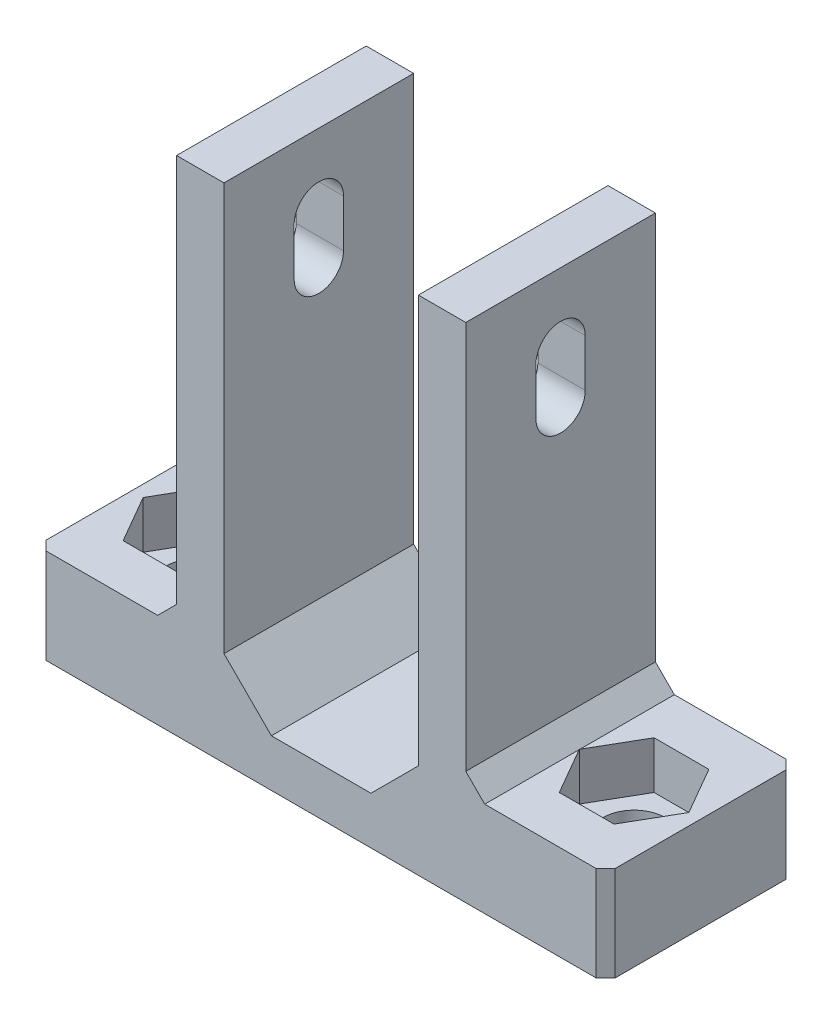
from build123d import *

# Parameters (mm, degrees)
SKETCH2_W           = 60
SKETCH2_H           = 20
SKETCH2_R           = 3.3
BOSS_EXTRUDE2_DEPTH = 5
SKETCH3_W           = 5
SKETCH3_H           = 48
BOSS_EXTRUDE3_DEPTH = 20
CUT_EXTRUDE1_REACH  = 72.403
SKETCH5_W           = 14.75
SKETCH5_H           = 20
BOSS_EXTRUDE4_DEPTH = 5
CHAMFER1_SIZE       = 2
CHAMFER2_SIZE       = 5
CHAMFER3_SIZE       = 1


with BuildPart() as part:
    # Sketch2 → Boss-Extrude2 (new body)
    with BuildSketch(Plane(origin=(0, 0, 0), x_dir=(1, 0, 0), z_dir=(0, 1, 0))):
        Rectangle(SKETCH2_W, SKETCH2_H)
        with Locations(Location((-23, 0, 0), (0, 0, 270))):
            Circle(SKETCH2_R, mode=Mode.SUBTRACT)
        with Locations(Location((23, 0, 0), (0, 0, 270))):
            Circle(SKETCH2_R, mode=Mode.SUBTRACT)
    extrude(amount=BOSS_EXTRUDE2_DEPTH)

    # Sketch3 → Boss-Extrude3 (add)
    with BuildSketch(Plane.XY.offset(10)):
        with Locations((-12.75, 29)):
            Rectangle(SKETCH3_W, SKETCH3_H)
        with Locations((12.75, 29)):
            Rectangle(SKETCH3_W, SKETCH3_H)
    extrude(amount=-BOSS_EXTRUDE3_DEPTH)

    # Cut-Extrude1: up to this face of the body (flat: up to its plane)
    cut_extrude1_end = Plane(part.part.faces().sort_by_distance((-15.25, 29, 0))[0])
    # Sketch4 → Cut-Extrude1 (cut, up to the picked face)
    with BuildSketch(Plane(origin=(15.25, 0, 0), x_dir=(0, 0, -1), z_dir=(1, 0, 0)), mode=Mode.PRIVATE) as cut_extrude1_sk1:
        with BuildLine():
            Line((2.6, 45.5), (2.6, 40.5))
            ThreePointArc((2.6, 40.5), (0, 37.9), (-2.6, 40.5))
            Line((-2.6, 40.5), (-2.6, 45.5))
            ThreePointArc((-2.6, 45.5), (0, 48.1), (2.6, 45.5))
        make_face()
    cut_extrude1_tool1 = split(extrude(cut_extrude1_sk1.sketch, amount=-CUT_EXTRUDE1_REACH, mode=Mode.PRIVATE), bisect_by=cut_extrude1_end, keep=Keep.BOTH, mode=Mode.PRIVATE)
    add(cut_extrude1_tool1.solids().sort_by(Axis((15.25, 43, 0), (-1, 0, 0)))[0], mode=Mode.SUBTRACT)

    # Sketch5 → Boss-Extrude4 (add)
    # profile 1 of 2: a face of its own
    with BuildSketch(Plane(origin=(0, 5, 0), x_dir=(1, 0, 0), z_dir=(0, 1, 0))):
        with Locations((22.625, 0)):
            Rectangle(SKETCH5_W, SKETCH5_H)
        Polygon((28.773502692, 0), (25.886751346, 5), (20.113248654, 5), (17.226497308, 0), (20.113248654, -5), (25.886751346, -5), align=None, mode=Mode.SUBTRACT)
    # profile 2 of 2: a face of its own
    with BuildSketch(Plane(origin=(0, 5, 0), x_dir=(1, 0, 0), z_dir=(0, 1, 0))):
        with Locations((-22.625, 0)):
            Rectangle(SKETCH5_W, SKETCH5_H)
        Polygon((-17.226497308, 0), (-20.113248654, 5), (-25.886751346, 5), (-28.773502692, 0), (-25.886751346, -5), (-20.113248654, -5), align=None, mode=Mode.SUBTRACT)
    extrude(amount=BOSS_EXTRUDE4_DEPTH)

    # Chamfer1
    # the kernel refuses this chamfer: 2 mm, written as the material it adds along each edge
    with BuildSketch(Plane(origin=(15.25, 10, -10), x_dir=(0.9996219169112968, -0.02749587661058651, 0), z_dir=(0, 0, 1))) as chamfer1_piece_1_section:
        Polygon((CHAMFER1_SIZE * 0.999621916911, CHAMFER1_SIZE * 0.0274958766106), (-CHAMFER1_SIZE * 0.0274958766106, CHAMFER1_SIZE * 0.999621916911), (0, 0), align=None)
    chamfer1_piece_1 = extrude(amount=20, mode=Mode.PRIVATE)
    chamfer1_piece_1 = split(chamfer1_piece_1, bisect_by=Plane(origin=(14.273862805, 10.629145716, -5.114112976), z_dir=(0.8660254037844387, 0, -0.49999999999999994)), keep=Keep.TOP, mode=Mode.PRIVATE)
    chamfer1_piece_1 = split(chamfer1_piece_1, bisect_by=Plane(origin=(19.549147449, 10.629145716, -4.022948051), z_dir=(-0.8660254037844387, 0, -0.49999999999999994)), keep=Keep.TOP, mode=Mode.PRIVATE)
    add(chamfer1_piece_1)
    with BuildSketch(Plane(origin=(15.25, 10, -10), x_dir=(0.9996219169112968, -0.02749587661058651, 0), z_dir=(0, 0, 1))) as chamfer1_piece_2_section:
        Polygon((CHAMFER1_SIZE * 0.999621916911, CHAMFER1_SIZE * 0.0274958766106), (-CHAMFER1_SIZE * 0.0274958766106, CHAMFER1_SIZE * 0.999621916911), (0, 0), align=None)
    chamfer1_piece_2 = extrude(amount=20, mode=Mode.PRIVATE)
    chamfer1_piece_2 = split(chamfer1_piece_2, bisect_by=Plane(origin=(16.849076721, 10.762644927, -0.653711633), z_dir=(-0.8660254037844387, 0, 0.49999999999999994)), keep=Keep.TOP, mode=Mode.PRIVATE)
    chamfer1_piece_2 = split(chamfer1_piece_2, bisect_by=Plane(origin=(16.849076721, 10.762644927, 0.653711633), z_dir=(-0.8660254037844387, 0, -0.49999999999999994)), keep=Keep.TOP, mode=Mode.PRIVATE)
    add(chamfer1_piece_2)
    with BuildSketch(Plane(origin=(15.25, 10, -10), x_dir=(0.9996219169112968, -0.02749587661058651, 0), z_dir=(0, 0, 1))) as chamfer1_piece_3_section:
        Polygon((CHAMFER1_SIZE * 0.999621916911, CHAMFER1_SIZE * 0.0274958766106), (-CHAMFER1_SIZE * 0.0274958766106, CHAMFER1_SIZE * 0.999621916911), (0, 0), align=None)
    chamfer1_piece_3 = extrude(amount=20, mode=Mode.PRIVATE)
    chamfer1_piece_3 = split(chamfer1_piece_3, bisect_by=Plane(origin=(19.549147449, 10.629145716, 4.022948051), z_dir=(-0.8660254037844387, 0, 0.49999999999999994)), keep=Keep.TOP, mode=Mode.PRIVATE)
    chamfer1_piece_3 = split(chamfer1_piece_3, bisect_by=Plane(origin=(14.273862805, 10.629145716, 5.114112976), z_dir=(0.8660254037844387, 0, 0.49999999999999994)), keep=Keep.TOP, mode=Mode.PRIVATE)
    add(chamfer1_piece_3)
    with BuildSketch(Plane(origin=(-15.25, 10, 10), x_dir=(0.027495876610586487, 0.9996219169112968, 0), z_dir=(0, 0, -1))) as chamfer1_piece_4_section:
        Polygon((CHAMFER1_SIZE * 0.999621916911, -CHAMFER1_SIZE * 0.0274958766106), (-CHAMFER1_SIZE * 0.0274958766106, -CHAMFER1_SIZE * 0.999621916911), (0, 0), align=None)
    chamfer1_piece_4 = extrude(amount=20, mode=Mode.PRIVATE)
    chamfer1_piece_4 = split(chamfer1_piece_4, bisect_by=Plane(origin=(-14.273862805, 10.629145716, 5.114112976), z_dir=(-0.8660254037844387, 0, 0.49999999999999994)), keep=Keep.TOP, mode=Mode.PRIVATE)
    chamfer1_piece_4 = split(chamfer1_piece_4, bisect_by=Plane(origin=(-19.549147449, 10.629145716, 4.022948051), z_dir=(0.8660254037844388, 0, 0.49999999999999967)), keep=Keep.TOP, mode=Mode.PRIVATE)
    add(chamfer1_piece_4)
    with BuildSketch(Plane(origin=(-15.25, 10, 10), x_dir=(0.027495876610586487, 0.9996219169112968, 0), z_dir=(0, 0, -1))) as chamfer1_piece_5_section:
        Polygon((CHAMFER1_SIZE * 0.999621916911, -CHAMFER1_SIZE * 0.0274958766106), (-CHAMFER1_SIZE * 0.0274958766106, -CHAMFER1_SIZE * 0.999621916911), (0, 0), align=None)
    chamfer1_piece_5 = extrude(amount=20, mode=Mode.PRIVATE)
    chamfer1_piece_5 = split(chamfer1_piece_5, bisect_by=Plane(origin=(-16.849076721, 10.762644927, 0.653711633), z_dir=(0.8660254037844387, 0, -0.49999999999999994)), keep=Keep.TOP, mode=Mode.PRIVATE)
    chamfer1_piece_5 = split(chamfer1_piece_5, bisect_by=Plane(origin=(-16.849076721, 10.762644927, -0.653711633), z_dir=(0.8660254037844388, 0, 0.49999999999999967)), keep=Keep.TOP, mode=Mode.PRIVATE)
    add(chamfer1_piece_5)
    with BuildSketch(Plane(origin=(-15.25, 10, 10), x_dir=(0.027495876610586487, 0.9996219169112968, 0), z_dir=(0, 0, -1))) as chamfer1_piece_6_section:
        Polygon((CHAMFER1_SIZE * 0.999621916911, -CHAMFER1_SIZE * 0.0274958766106), (-CHAMFER1_SIZE * 0.0274958766106, -CHAMFER1_SIZE * 0.999621916911), (0, 0), align=None)
    chamfer1_piece_6 = extrude(amount=20, mode=Mode.PRIVATE)
    chamfer1_piece_6 = split(chamfer1_piece_6, bisect_by=Plane(origin=(-19.549147449, 10.629145716, -4.022948051), z_dir=(0.8660254037844387, 0, -0.49999999999999994)), keep=Keep.TOP, mode=Mode.PRIVATE)
    chamfer1_piece_6 = split(chamfer1_piece_6, bisect_by=Plane(origin=(-14.273862805, 10.629145716, -5.114112976), z_dir=(-0.8660254037844388, 0, -0.49999999999999967)), keep=Keep.TOP, mode=Mode.PRIVATE)
    add(chamfer1_piece_6)

    # Chamfer2
    chamfer2_edges = [part.edges().sort_by_distance(p)[0] for p in [
        (-10.25, 5, 0),
        (10.25, 5, 0),
    ]]
    chamfer(chamfer2_edges, length=CHAMFER2_SIZE)

    # Chamfer3
    chamfer3_edges = [part.edges().sort_by_distance(p)[0] for p in [
        (30, 5, 10),
        (-30, 5, 10),
        (-30, 5, -10),
        (30, 5, -10),
    ]]
    chamfer(chamfer3_edges, length=CHAMFER3_SIZE)


solid = part.part
